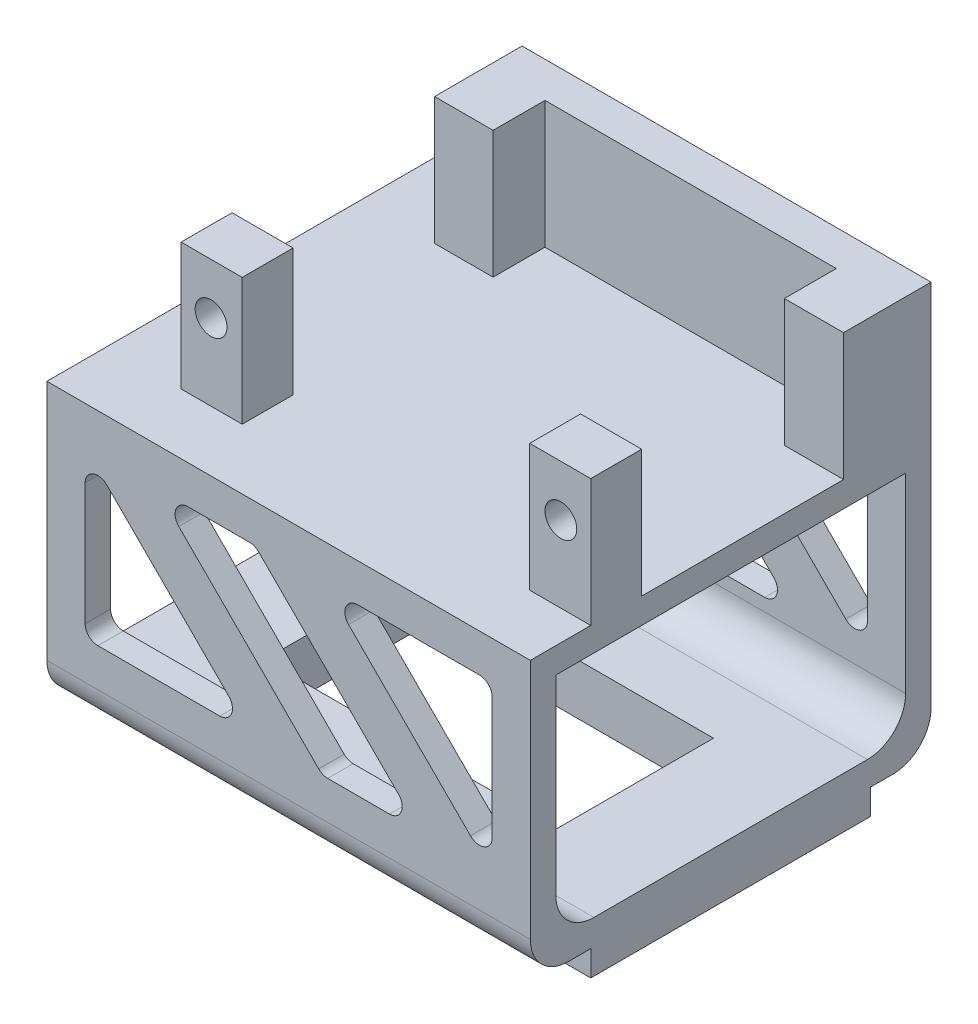
from build123d import *

# Parameters (mm, degrees)
SKETCH1_W           = 38
SKETCH1_H           = 22
SKETCH1_W_2         = 23
SKETCH1_H_2         = 12.3
BOSS_EXTRUDE1_DEPTH = 4
BOSS_EXTRUDE2_DEPTH = 38
FILLET1_R           = 3
CUT_EXTRUDE5_DEPTH  = 44.923228479
FILLET3_R           = 1
MIRROR1_START       = 13.75
MIRROR1_DEPTH       = 2
SKETCH10_W          = 4.8
SKETCH10_H          = 4
BOSS_EXTRUDE4_DEPTH = 10
SKETCH11_R          = 1.25
CUT_EXTRUDE6_DEPTH  = 48.25
BOSS_EXTRUDE5_DEPTH = 10
BOSS_EXTRUDE6_START = -15.75
SKETCH14_R          = 1.5
BOSS_EXTRUDE6_DEPTH = 2
FILLET4_R           = 0.7


# Read off the part's stored shape, not the designer's step: Mirror1
with BuildPart() as part:
    # Sketch1 → Boss-Extrude1 (new body)
    with BuildSketch(Plane(origin=(0, 0, 0), x_dir=(1, 0, 0), z_dir=(0, 1, 0))):
        Rectangle(SKETCH1_W, SKETCH1_H)
        Rectangle(SKETCH1_W_2, SKETCH1_H_2, mode=Mode.SUBTRACT)
    extrude(amount=BOSS_EXTRUDE1_DEPTH)

    # Sketch2 → Boss-Extrude2 (add)
    with BuildSketch(Plane.ZY.offset(19)):
        Polygon((-11, 2), (-15.75, 2), (-15.75, 22), (-15.75, 24), (15.75, 24), (15.75, 22), (15.75, 2), (11, 2), (11, 4), (13.75, 4), (13.75, 22), (-13.75, 22), (-13.75, 4), (-11, 4), align=None)
    extrude(amount=-BOSS_EXTRUDE2_DEPTH)

    # Fillet1
    fillet1_edges = [part.edges().sort_by_distance(p)[0] for p in [
        (0, 2, -15.75),
        (0, 2, 15.75),
        (0, 4, 13.75),
        (0, 4, -13.75),
    ]]
    fillet(fillet1_edges, radius=FILLET1_R)

    # Sketch8 → Cut-Extrude5 (cut, through all)
    with BuildSketch(Plane(origin=(0, 0, -15.75), x_dir=(-1, 0, 0), z_dir=(0, 0, -1))):
        Polygon((-16, 8), (-16, 21), (-3, 21), align=None)
        Polygon((3, 8), (16, 21), (16, 8), align=None)
        Polygon((-10.343145751, 8), (-2.656854249, 8), (10.343145751, 21), (2.656854249, 21), align=None)
    extrude(amount=-CUT_EXTRUDE5_DEPTH, mode=Mode.SUBTRACT)

    # Fillet3
    fillet3_edges = [part.edges().sort_by_distance(p)[0] for p in [
        (-16, 8, -14.75),
        (-3, 8, -14.75),
        (-16, 21, -14.75),
        (10.343145751, 8, -14.75),
        (-2.656854249, 21, -14.75),
        (-10.343145751, 21, -14.75),
        (2.656854249, 8, -14.75),
        (3, 21, -14.75),
        (16, 8, -14.75),
        (16, 21, -14.75),
    ]]
    fillet(fillet3_edges, radius=FILLET3_R)

    # Mirror1 outline → Mirror1 (add)
    with BuildSketch(Plane.XY.offset(MIRROR1_START)):
        with BuildLine():
            ThreePointArc((15, 21), (15.707106781, 20.707106781), (16, 20))
            Line((16, 20), (16, 21))
            Line((16, 21), (15, 21))
        make_face()
        with BuildLine():
            Line((16, 8), (16, 10.414213562))
            ThreePointArc((16, 10.414213562), (15.382683432, 9.49033403), (14.292893219, 9.707106781))
            Line((14.292893219, 9.707106781), (16, 8))
        make_face()
        with BuildLine():
            ThreePointArc((4.707106781, 19.292893219), (4.49033403, 20.382683432), (5.414213562, 21))
            Line((5.414213562, 21), (3, 21))
            Line((3, 21), (4.707106781, 19.292893219))
        make_face()
        with BuildLine():
            ThreePointArc((-15, 8), (-15.707106781, 8.292893219), (-16, 9))
            Line((-16, 9), (-16, 8))
            Line((-16, 8), (-15, 8))
        make_face()
        with BuildLine():
            Line((-16, 21), (-16, 18.585786438))
            ThreePointArc((-16, 18.585786438), (-15.382683432, 19.50966597), (-14.292893219, 19.292893219))
            Line((-14.292893219, 19.292893219), (-16, 21))
        make_face()
        with BuildLine():
            ThreePointArc((-4.707106781, 9.707106781), (-4.49033403, 8.617316568), (-5.414213562, 8))
            Line((-5.414213562, 8), (-3, 8))
            Line((-3, 8), (-4.707106781, 9.707106781))
        make_face()
        with BuildLine():
            ThreePointArc((8.636038969, 9.707106781), (8.852811721, 8.617316567), (7.928932188, 8))
            Line((7.928932188, 8), (10.343145751, 8))
            Line((10.343145751, 8), (8.636038969, 9.707106781))
        make_face()
        with BuildLine():
            Line((2.656854249, 8), (3.071067812, 8))
            ThreePointArc((3.071067812, 8), (2.68838438, 8.076120467), (2.363961031, 8.292893219))
            Line((2.363961031, 8.292893219), (2.656854249, 8))
        make_face()
        with BuildLine():
            ThreePointArc((-3.071067812, 21), (-2.68838438, 20.923879533), (-2.363961031, 20.707106781))
            Line((-2.363961031, 20.707106781), (-2.656854249, 21))
            Line((-2.656854249, 21), (-3.071067812, 21))
        make_face()
        with BuildLine():
            Line((-10.343145751, 21), (-8.636038969, 19.292893219))
            ThreePointArc((-8.636038969, 19.292893219), (-8.852811721, 20.382683433), (-7.928932188, 21))
            Line((-7.928932188, 21), (-10.343145751, 21))
        make_face()
    extrude(amount=MIRROR1_DEPTH)

    # Sketch10 → Boss-Extrude4 (add)
    with BuildSketch(Plane(origin=(0, 24, 0), x_dir=(1, 0, 0), z_dir=(0, 1, 0))):
        with Locations((-10.8, -9)):
            Rectangle(SKETCH10_W, SKETCH10_H)
        with Locations((16.6, -9)):
            Rectangle(SKETCH10_W, SKETCH10_H)
    extrude(amount=BOSS_EXTRUDE4_DEPTH)

    # Sketch11 → Cut-Extrude6 (cut, through all)
    with BuildSketch(Plane.XY.offset(11)):
        with Locations((16.65, 30)):
            Circle(SKETCH11_R)
        with Locations((-10.85, 30)):
            Circle(SKETCH11_R)
    extrude(amount=-CUT_EXTRUDE6_DEPTH, mode=Mode.SUBTRACT)

    # Sketch12 → Boss-Extrude5 (add)
    with BuildSketch(Plane(origin=(0, 24, 0), x_dir=(1, 0, 0), z_dir=(0, 1, 0))):
        Polygon((-8.55, 8.870549132), (-13.15, 8.870549132), (-13.15, 15.75), (19, 15.75), (19, 8.870549132), (14.35, 8.870549132), (14.35, 12.95), (-8.55, 12.95), align=None)
    extrude(amount=BOSS_EXTRUDE5_DEPTH)

    # Sketch14 → Boss-Extrude6 (add)
    with BuildSketch(Plane.XY.offset(BOSS_EXTRUDE6_START)):
        with Locations(Location((8.25, 30, 0), (0, 0, 180))):
            Circle(SKETCH14_R)
    extrude(amount=-BOSS_EXTRUDE6_DEPTH)

    # Fillet4
    fillet4_edges = [part.edges().sort_by_distance(p)[0] for p in [
        (9.75, 30, -17.75),
    ]]
    fillet(fillet4_edges, radius=FILLET4_R)


solid = part.part
